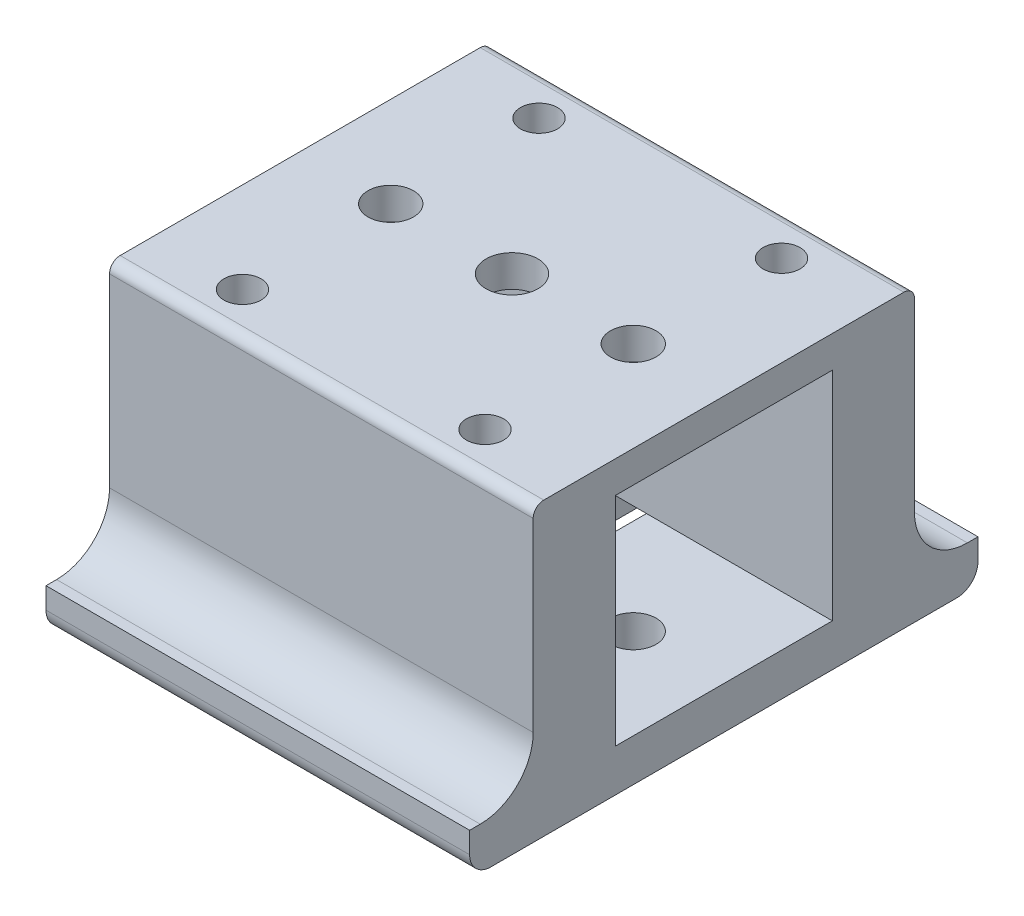
from build123d import *

# Parameters (mm, degrees)
SKETCH_1_W                = 40
SKETCH_1_H                = 48
SKETCH_1_R                = 1.75
EXTRUDE_1_DEPTH           = 4
SKETCH_2_W                = 40
SKETCH_2_H                = 7.75
EXTRUDE_5_DEPTH           = 20.5
SKETCH_4_W                = 40
SKETCH_4_H                = 36
EXTRUDE_6_DEPTH           = 3
FILLET_4_R                = 5
FILLET_5_R                = 5
FILLET_7_R                = 2
FILLET_8_R                = 2
CUT_EXTRUDE_START         = -27.5
CUT_EXTRUDE_1_OUTLINE_R   = 1.75
CUT_EXTRUDE_1_OUTLINE_R_2 = 2.15
CUT_EXTRUDE_1_DEPTH       = 27.5
FILLET_9_R                = 1
FILLET_10_R               = 1
SKETCH_6_R                = 2.45
CUT_EXTRUDE_2_DEPTH       = 42.620307543


# Read off the part's stored shape, not the designer's step: 切除-拉伸1
with BuildPart() as part:
    # 草图1 → 凸台-拉伸1 (new body)
    with BuildSketch(Plane(origin=(0, 0, 0), x_dir=(1, 0, 0), z_dir=(0, 1, 0))):
        Rectangle(SKETCH_1_W, SKETCH_1_H)
        with Locations(Location((11.45, 14, 0), (0, 0, 270))):
            Circle(SKETCH_1_R, mode=Mode.SUBTRACT)
        with Locations(Location((-11.45, 14, 0), (0, 0, 270))):
            Circle(SKETCH_1_R, mode=Mode.SUBTRACT)
        with Locations(Location((-11.45, -14, 0), (0, 0, 270))):
            Circle(SKETCH_1_R, mode=Mode.SUBTRACT)
        with Locations(Location((11.45, -14, 0), (0, 0, 270))):
            Circle(SKETCH_1_R, mode=Mode.SUBTRACT)
        with BuildLine():
            Line((-2.45, -15.5), (-2.45, 15.5))
            ThreePointArc((-2.45, 15.5), (0, 17.95), (2.45, 15.5))
            Line((2.45, 15.5), (2.45, -15.5))
            ThreePointArc((2.45, -15.5), (0, -17.95), (-2.45, -15.5))
        make_face(mode=Mode.SUBTRACT)
    extrude(amount=EXTRUDE_1_DEPTH)

    # 草图2 → 凸台-拉伸5 (add)
    with BuildSketch(Plane(origin=(0, 4, 0), x_dir=(1, 0, 0), z_dir=(0, 1, 0))):
        with Locations((0, -14.125)):
            Rectangle(SKETCH_2_W, SKETCH_2_H)
        with Locations((0, 14.125)):
            Rectangle(SKETCH_2_W, SKETCH_2_H)
    extrude(amount=EXTRUDE_5_DEPTH)

    # 草图4 → 凸台-拉伸6 (add)
    with BuildSketch(Plane(origin=(0, 24.5, 0), x_dir=(1, 0, 0), z_dir=(0, 1, 0))):
        Rectangle(SKETCH_4_W, SKETCH_4_H)
    extrude(amount=EXTRUDE_6_DEPTH)

    # 圆角4
    fillet_4_edges = [part.edges().sort_by_distance(p)[0] for p in [
        (0, 4, -18),
    ]]
    fillet(fillet_4_edges, radius=FILLET_4_R)

    # 圆角5
    fillet_5_edges = [part.edges().sort_by_distance(p)[0] for p in [
        (0, 4, 18),
    ]]
    fillet(fillet_5_edges, radius=FILLET_5_R)

    # 圆角7
    fillet_7_edges = [part.edges().sort_by_distance(p)[0] for p in [
        (0, 0, 24),
    ]]
    fillet(fillet_7_edges, radius=FILLET_7_R)

    # 圆角8
    fillet_8_edges = [part.edges().sort_by_distance(p)[0] for p in [
        (0, 0, -24),
    ]]
    fillet(fillet_8_edges, radius=FILLET_8_R)

    # 切除-拉伸1 outline → 切除-拉伸1 (cut)
    with BuildSketch(Plane.XZ.offset(CUT_EXTRUDE_START)):
        with Locations((-11.45, 14)):
            Circle(CUT_EXTRUDE_1_OUTLINE_R)
        with Locations((-11.45, -14)):
            Circle(CUT_EXTRUDE_1_OUTLINE_R)
        with Locations((11.45, -14)):
            Circle(CUT_EXTRUDE_1_OUTLINE_R)
        with Locations((11.45, 14)):
            Circle(CUT_EXTRUDE_1_OUTLINE_R)
        with Locations((-11.45, 0)):
            Circle(CUT_EXTRUDE_1_OUTLINE_R_2)
        with Locations((11.45, 0)):
            Circle(CUT_EXTRUDE_1_OUTLINE_R_2)
    extrude(amount=CUT_EXTRUDE_1_DEPTH, mode=Mode.SUBTRACT)

    # 圆角9
    fillet_9_edges = [part.edges().sort_by_distance(p)[0] for p in [
        (0, 27.5, 18),
    ]]
    fillet(fillet_9_edges, radius=FILLET_9_R)

    # 圆角10
    fillet_10_edges = [part.edges().sort_by_distance(p)[0] for p in [
        (0, 27.5, -18),
    ]]
    fillet(fillet_10_edges, radius=FILLET_10_R)

    # 草图6 → 切除-拉伸2 (cut, through all)
    with BuildSketch(Plane.XZ):
        with Locations(Location((0, 0, 0), (0, 0, 270))):
            Circle(SKETCH_6_R)
    extrude(amount=-CUT_EXTRUDE_2_DEPTH, mode=Mode.SUBTRACT)


solid = part.part
